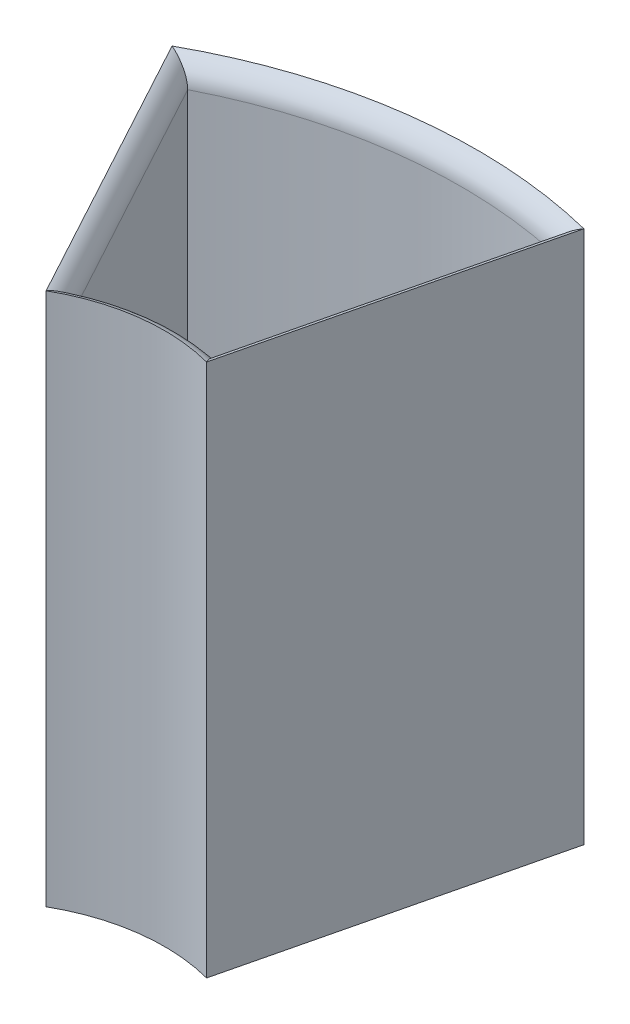
from build123d import *

# Parameters (mm, degrees)
BOSS_EXTRUDE1_DEPTH = 2
BOSS_EXTRUDE2_DEPTH = 65
FILLET1_R           = 3


with BuildPart() as part:
    # Sketch1 → Boss-Extrude1 (new body)
    with BuildSketch(Plane(origin=(0, 0, 0), x_dir=(1, 0, 0), z_dir=(0, 1, 0))):
        with BuildLine():
            Line((-10.560958787, 22.659791471), (-26.773952234, 52.575236393))
            ThreePointArc((-26.773952234, 52.575236393), (-7.656070137, 58.501150331), (12.342908564, 57.69447641))
            Line((12.342908564, 57.69447641), (4.374170949, 24.614358178))
            ThreePointArc((4.374170949, 24.614358178), (-3.244097516, 24.788623022), (-10.560958787, 22.659791471))
        make_face()
    extrude(amount=BOSS_EXTRUDE1_DEPTH)

    # Sketch1<3> → Boss-Extrude2 (add)
    with BuildSketch(Plane(origin=(0, 0, 0), x_dir=(1, 0, 0), z_dir=(0, 1, 0))):
        with BuildLine():
            ThreePointArc((5.859670357, 22.24104906), (-2.984569714, 22.80553318), (-11.385698648, 19.984140369))
            Line((-11.385698648, 19.984140369), (-29.493588104, 53.395957344))
            ThreePointArc((-29.493588104, 53.395957344), (-7.915597938, 60.484240173), (14.75975536, 59.187411007))
            Line((14.75975536, 59.187411007), (5.859670357, 22.24104906))
        make_face()
        with BuildLine():
            Line((4.374170949, 24.614358178), (12.342908564, 57.69447641))
            ThreePointArc((12.342908564, 57.69447641), (-7.656070137, 58.501150331), (-26.773952234, 52.575236393))
            Line((-26.773952234, 52.575236393), (-10.560958787, 22.659791471))
            ThreePointArc((-10.560958787, 22.659791471), (-3.244097516, 24.788623022), (4.374170949, 24.614358178))
        make_face(mode=Mode.SUBTRACT)
    extrude(amount=BOSS_EXTRUDE2_DEPTH)

    # Fillet1
    # the kernel refuses this fillet: 3 mm, written as the material it adds along each edge
    with BuildSketch(Plane(origin=(-6.987336603, 2, -16.065913667), x_dir=(0, 1, 0), z_dir=(-0.4764829578611926, 0, -0.879183707121469))) as fillet1_piece_1_section:
        with BuildLine():
            CenterArc((FILLET1_R, FILLET1_R), FILLET1_R, 180, 90)
            Line((0, FILLET1_R), (0, 0))
            Line((0, 0), (FILLET1_R, 0))
        make_face()
    fillet1_piece_1 = extrude(amount=49.02638684, mode=Mode.PRIVATE)
    fillet1_piece_1 = fillet1_piece_1 & Plane(origin=(0, 2, 0), x_dir=(0.20920184006511774, 0, -0.977872481519635), z_dir=(0, -1, 0)) * Cylinder(59, 111, mode=Mode.PRIVATE)
    fillet1_piece_1 = fillet1_piece_1 - Plane(origin=(0, 2, 0), x_dir=(-0.4224383514814905, 0, -0.9063916588305525), z_dir=(0, -1, 0)) * Cylinder(25, 111, mode=Mode.PRIVATE)
    add(fillet1_piece_1)
    with BuildSketch(Plane(origin=(0, 2, 0), x_dir=(0.4581300705855368, 0, -0.8888851660508748), z_dir=(0.8888851660508748, 0, 0.4581300705855368))) as fillet1_piece_2_section:
        with BuildLine():
            CenterArc((25 + FILLET1_R, FILLET1_R), FILLET1_R, 180, 90)
            Line((25 + FILLET1_R, 0), (25, 0))
            Line((25, 0), (25, FILLET1_R))
        make_face()
    fillet1_piece_2 = revolve(axis=Axis((0, 2, 0), (0, 1, 0)), revolution_arc=69.444918607, mode=Mode.PRIVATE)
    fillet1_piece_2 = split(fillet1_piece_2, bisect_by=Plane(origin=(-1.469933591, 2, -0.354095322), z_dir=(-0.9721901531046743, 0, -0.23419288248431033)), keep=Keep.TOP, mode=Mode.PRIVATE)
    fillet1_piece_2 = split(fillet1_piece_2, bisect_by=Plane(origin=(1.329309559, 2, -0.720433449), z_dir=(0.879183707121469, 0, -0.4764829578611926)), keep=Keep.TOP, mode=Mode.PRIVATE)
    add(fillet1_piece_2)
    with BuildSketch(Plane(origin=(14.099355182, 2, -64.985902558), x_dir=(0, 1, 0), z_dir=(-0.23419288248431033, 0, 0.9721901531046743))) as fillet1_piece_3_section:
        with BuildLine():
            CenterArc((FILLET1_R, FILLET1_R), FILLET1_R, 180, 90)
            Line((0, FILLET1_R), (0, 0))
            Line((0, 0), (FILLET1_R, 0))
        make_face()
    fillet1_piece_3 = extrude(amount=49.02638684, mode=Mode.PRIVATE)
    fillet1_piece_3 = fillet1_piece_3 & Plane(origin=(0, 2, 0), x_dir=(0.20920184006511774, 0, -0.977872481519635), z_dir=(0, -1, 0)) * Cylinder(59, 111, mode=Mode.PRIVATE)
    fillet1_piece_3 = fillet1_piece_3 - Plane(origin=(0, 2, 0), x_dir=(-0.4224383514814905, 0, -0.9063916588305525), z_dir=(0, -1, 0)) * Cylinder(25, 111, mode=Mode.PRIVATE)
    add(fillet1_piece_3)
    with BuildSketch(Plane(origin=(0, 2, 0), x_dir=(-0.5631135264188442, 0, -0.8263795474018787), z_dir=(-0.8263795474018787, 0, 0.5631135264188442))) as fillet1_piece_4_section:
        with BuildLine():
            CenterArc((59 - FILLET1_R, -FILLET1_R), FILLET1_R, 0, 90)
            Line((59 - FILLET1_R, 0), (59, 0))
            Line((59, 0), (59, -FILLET1_R))
        make_face()
    fillet1_piece_4 = revolve(axis=Axis((0, 2, 0), (0, -1, 0)), revolution_arc=53.630888503, mode=Mode.PRIVATE)
    fillet1_piece_4 = split(fillet1_piece_4, bisect_by=Plane(origin=(-1.469933591, 2, -0.354095322), z_dir=(-0.9721901531046743, 0, -0.23419288248431033)), keep=Keep.TOP, mode=Mode.PRIVATE)
    fillet1_piece_4 = split(fillet1_piece_4, bisect_by=Plane(origin=(1.329309559, 2, -0.720433449), z_dir=(0.879183707121469, 0, -0.4764829578611926)), keep=Keep.TOP, mode=Mode.PRIVATE)
    add(fillet1_piece_4)
    # the kernel refuses this fillet: 3 mm, written as the material it takes off along each edge
    with BuildSketch(Plane(origin=(0, 65, 0), x_dir=(-0.6714413755332248, 0, -0.7410576760428644), z_dir=(-0.7410576760428644, 0, 0.6714413755332248))) as fillet1_2_piece_1_section:
        with BuildLine():
            CenterArc((25 - FILLET1_R, FILLET1_R), FILLET1_R, 270, 90)
            Line((25, FILLET1_R), (25, 0))
            Line((25, 0), (25 - FILLET1_R, 0))
        make_face()
    fillet1_2_piece_1 = revolve(axis=Axis((0, 65, 0), (0, -1, 0)), revolution_arc=69.444918607, mode=Mode.PRIVATE)
    fillet1_2_piece_1 = split(fillet1_2_piece_1, bisect_by=Plane(origin=(-1.469933591, 65, -0.354095322), z_dir=(-0.9721901531046743, 0, -0.23419288248431033)), keep=Keep.TOP, mode=Mode.PRIVATE)
    fillet1_2_piece_1 = split(fillet1_2_piece_1, bisect_by=Plane(origin=(1.329309559, 65, -0.720433449), z_dir=(0.879183707121469, 0, -0.4764829578611926)), keep=Keep.TOP, mode=Mode.PRIVATE)
    add(fillet1_2_piece_1, mode=Mode.SUBTRACT)
    with BuildSketch(Plane(origin=(-30.347574418, 65, -59.169114196), x_dir=(-0.879183707121469, 0, 0.47648295786119255), z_dir=(0.4764829578611926, 0, 0.879183707121469))) as fillet1_2_piece_2_section:
        with BuildLine():
            CenterArc((FILLET1_R, FILLET1_R), FILLET1_R, 180, 90)
            Line((0, FILLET1_R), (0, 0))
            Line((0, 0), (FILLET1_R, 0))
        make_face()
    fillet1_2_piece_2 = extrude(amount=49.02638684, mode=Mode.PRIVATE)
    fillet1_2_piece_2 = fillet1_2_piece_2 & Plane(origin=(0, 65, 0), x_dir=(0.20920184006511774, 0, -0.977872481519635), z_dir=(0, -1, 0)) * Cylinder(59, 111, mode=Mode.PRIVATE)
    fillet1_2_piece_2 = fillet1_2_piece_2 - Plane(origin=(0, 65, 0), x_dir=(-0.4224383514814905, 0, -0.9063916588305525), z_dir=(0, -1, 0)) * Cylinder(25, 111, mode=Mode.PRIVATE)
    add(fillet1_2_piece_2, mode=Mode.SUBTRACT)
    with BuildSketch(Plane(origin=(2.617724331, 65, -17.32293203), x_dir=(0.9721901531046743, 0, 0.23419288248431033), z_dir=(0.23419288248431033, 0, -0.9721901531046743))) as fillet1_2_piece_3_section:
        with BuildLine():
            CenterArc((FILLET1_R, FILLET1_R), FILLET1_R, 180, 90)
            Line((0, FILLET1_R), (0, 0))
            Line((0, 0), (FILLET1_R, 0))
        make_face()
    fillet1_2_piece_3 = extrude(amount=49.02638684, mode=Mode.PRIVATE)
    fillet1_2_piece_3 = fillet1_2_piece_3 & Plane(origin=(0, 65, 0), x_dir=(0.20920184006511774, 0, -0.977872481519635), z_dir=(0, -1, 0)) * Cylinder(59, 111, mode=Mode.PRIVATE)
    fillet1_2_piece_3 = fillet1_2_piece_3 - Plane(origin=(0, 65, 0), x_dir=(-0.4224383514814905, 0, -0.9063916588305525), z_dir=(0, -1, 0)) * Cylinder(25, 111, mode=Mode.PRIVATE)
    add(fillet1_2_piece_3, mode=Mode.SUBTRACT)
    with BuildSketch(Plane(origin=(0, 65, 0), x_dir=(0.33149424176414766, 0, -0.9434572421033254), z_dir=(0.9434572421033254, 0, 0.33149424176414766))) as fillet1_2_piece_4_section:
        with BuildLine():
            CenterArc((59 + FILLET1_R, -FILLET1_R), FILLET1_R, 90, 90)
            Line((59, -FILLET1_R), (59, 0))
            Line((59, 0), (59 + FILLET1_R, 0))
        make_face()
    fillet1_2_piece_4 = revolve(axis=Axis((0, 65, 0), (0, 1, 0)), revolution_arc=53.630888503, mode=Mode.PRIVATE)
    fillet1_2_piece_4 = split(fillet1_2_piece_4, bisect_by=Plane(origin=(-1.469933591, 65, -0.354095322), z_dir=(-0.9721901531046743, 0, -0.23419288248431033)), keep=Keep.TOP, mode=Mode.PRIVATE)
    fillet1_2_piece_4 = split(fillet1_2_piece_4, bisect_by=Plane(origin=(1.329309559, 65, -0.720433449), z_dir=(0.879183707121469, 0, -0.4764829578611926)), keep=Keep.TOP, mode=Mode.PRIVATE)
    add(fillet1_2_piece_4, mode=Mode.SUBTRACT)
    with BuildSketch(Plane(origin=(-30.347574418, 65, -59.169114196), x_dir=(-0.879183707121469, 0, 0.47648295786119255), z_dir=(0.4764829578611926, 0, 0.879183707121469))) as fillet1_2_piece_5a_section:
        with BuildLine():
            CenterArc((FILLET1_R, FILLET1_R), FILLET1_R, 180, 90)
            Line((0, FILLET1_R), (0, 0))
            Line((0, 0), (FILLET1_R, 0))
        make_face()
    fillet1_2_piece_5a = extrude(amount=49.02638684, mode=Mode.PRIVATE)
    fillet1_2_piece_5a = fillet1_2_piece_5a - Plane(origin=(0, 65, 0), x_dir=(0.25476827639356225, 0, -0.9670021330604465), z_dir=(0, -1, 0)) * Cylinder(23, 111, mode=Mode.PRIVATE)
    fillet1_2_piece_5a = split(fillet1_2_piece_5a, bisect_by=Plane(origin=(-32.105941832, 65, -58.216148281), z_dir=(0.8791837071214691, 0, -0.47648295786119255)), keep=Keep.TOP, mode=Mode.PRIVATE)
    fillet1_2_piece_5a = fillet1_2_piece_5a & Plane(origin=(0, 65, 0), x_dir=(-0.4224383514814905, 0, -0.9063916588305525), z_dir=(0, -1, 0)) * Cylinder(25, 111, mode=Mode.PRIVATE)
    with BuildSketch(Plane(origin=(0, 65, 0), x_dir=(-0.6714413755332248, 0, -0.7410576760428644), z_dir=(-0.7410576760428644, 0, 0.6714413755332248))) as fillet1_2_piece_5b_section:
        with BuildLine():
            CenterArc((25 - FILLET1_R, FILLET1_R), FILLET1_R, 270, 90)
            Line((25, FILLET1_R), (25, 0))
            Line((25, 0), (25 - FILLET1_R, 0))
        make_face()
    fillet1_2_piece_5b = revolve(axis=Axis((0, 65, 0), (0, -1, 0)), revolution_arc=69.444918607, mode=Mode.PRIVATE)
    fillet1_2_piece_5b = fillet1_2_piece_5b - Plane(origin=(0, 65, 0), x_dir=(0.25476827639356225, 0, -0.9670021330604465), z_dir=(0, -1, 0)) * Cylinder(23, 100, mode=Mode.PRIVATE)
    fillet1_2_piece_5b = split(fillet1_2_piece_5b, bisect_by=Plane(origin=(-0.429057855, 65, 0.232532466), z_dir=(0.8791837071214691, 0, -0.47648295786119255)), keep=Keep.TOP, mode=Mode.PRIVATE)
    fillet1_2_piece_5b = split(fillet1_2_piece_5b, bisect_by=Plane(origin=(1.329309559, 65, -0.720433449), z_dir=(-0.879183707121469, 0, 0.4764829578611926)), keep=Keep.TOP, mode=Mode.PRIVATE)
    fillet1_2_piece_5 = fillet1_2_piece_5a & fillet1_2_piece_5b
    add(fillet1_2_piece_5, mode=Mode.SUBTRACT)
    with BuildSketch(Plane(origin=(2.617724331, 65, -17.32293203), x_dir=(0.9721901531046743, 0, 0.23419288248431033), z_dir=(0.23419288248431033, 0, -0.9721901531046743))) as fillet1_2_piece_6a_section:
        with BuildLine():
            CenterArc((FILLET1_R, FILLET1_R), FILLET1_R, 180, 90)
            Line((0, FILLET1_R), (0, 0))
            Line((0, 0), (FILLET1_R, 0))
        make_face()
    fillet1_2_piece_6a = extrude(amount=49.02638684, mode=Mode.PRIVATE)
    fillet1_2_piece_6a = split(fillet1_2_piece_6a, bisect_by=Plane(origin=(4.562104637, 65, -16.854546265), z_dir=(-0.9721901531046744, 0, -0.23419288248431033)), keep=Keep.TOP, mode=Mode.PRIVATE)
    fillet1_2_piece_6a = fillet1_2_piece_6a - Plane(origin=(0, 65, 0), x_dir=(0.25476827639356225, 0, -0.9670021330604465), z_dir=(0, -1, 0)) * Cylinder(23, 111, mode=Mode.PRIVATE)
    fillet1_2_piece_6a = fillet1_2_piece_6a & Plane(origin=(0, 65, 0), x_dir=(-0.4224383514814905, 0, -0.9063916588305525), z_dir=(0, -1, 0)) * Cylinder(25, 111, mode=Mode.PRIVATE)
    with BuildSketch(Plane(origin=(0, 65, 0), x_dir=(-0.6714413755332248, 0, -0.7410576760428644), z_dir=(-0.7410576760428644, 0, 0.6714413755332248))) as fillet1_2_piece_6b_section:
        with BuildLine():
            CenterArc((25 - FILLET1_R, FILLET1_R), FILLET1_R, 270, 90)
            Line((25, FILLET1_R), (25, 0))
            Line((25, 0), (25 - FILLET1_R, 0))
        make_face()
    fillet1_2_piece_6b = revolve(axis=Axis((0, 65, 0), (0, -1, 0)), revolution_arc=69.444918607, mode=Mode.PRIVATE)
    fillet1_2_piece_6b = split(fillet1_2_piece_6b, bisect_by=Plane(origin=(0.474446715, 65, 0.114290443), z_dir=(-0.9721901531046744, 0, -0.23419288248431033)), keep=Keep.TOP, mode=Mode.PRIVATE)
    fillet1_2_piece_6b = fillet1_2_piece_6b - Plane(origin=(0, 65, 0), x_dir=(0.25476827639356225, 0, -0.9670021330604465), z_dir=(0, -1, 0)) * Cylinder(23, 100, mode=Mode.PRIVATE)
    fillet1_2_piece_6b = split(fillet1_2_piece_6b, bisect_by=Plane(origin=(-1.469933591, 65, -0.354095322), z_dir=(0.9721901531046743, 0, 0.23419288248431033)), keep=Keep.TOP, mode=Mode.PRIVATE)
    fillet1_2_piece_6 = fillet1_2_piece_6a & fillet1_2_piece_6b
    add(fillet1_2_piece_6, mode=Mode.SUBTRACT)
    with BuildSketch(Plane(origin=(0, 65, 0), x_dir=(0.33149424176414766, 0, -0.9434572421033254), z_dir=(0.9434572421033254, 0, 0.33149424176414766))) as fillet1_2_piece_7a_section:
        with BuildLine():
            CenterArc((59 + FILLET1_R, -FILLET1_R), FILLET1_R, 90, 90)
            Line((59, -FILLET1_R), (59, 0))
            Line((59, 0), (59 + FILLET1_R, 0))
        make_face()
    fillet1_2_piece_7a = revolve(axis=Axis((0, 65, 0), (0, 1, 0)), revolution_arc=53.630888503, mode=Mode.PRIVATE)
    fillet1_2_piece_7a = fillet1_2_piece_7a & Plane(origin=(0, 65, 0), x_dir=(-0.4835014443344291, 0, -0.8753435630234113), z_dir=(0, -1, 0)) * Cylinder(61, 248, mode=Mode.PRIVATE)
    fillet1_2_piece_7a = split(fillet1_2_piece_7a, bisect_by=Plane(origin=(-0.429057855, 65, 0.232532466), z_dir=(0.8791837071214691, 0, -0.47648295786119255)), keep=Keep.TOP, mode=Mode.PRIVATE)
    fillet1_2_piece_7a = split(fillet1_2_piece_7a, bisect_by=Plane(origin=(1.329309559, 65, -0.720433449), z_dir=(-0.879183707121469, 0, 0.4764829578611926)), keep=Keep.TOP, mode=Mode.PRIVATE)
    with BuildSketch(Plane(origin=(-30.347574418, 65, -59.169114196), x_dir=(-0.879183707121469, 0, 0.47648295786119255), z_dir=(0.4764829578611926, 0, 0.879183707121469))) as fillet1_2_piece_7b_section:
        with BuildLine():
            CenterArc((FILLET1_R, FILLET1_R), FILLET1_R, 180, 90)
            Line((0, FILLET1_R), (0, 0))
            Line((0, 0), (FILLET1_R, 0))
        make_face()
    fillet1_2_piece_7b = extrude(amount=49.02638684, mode=Mode.PRIVATE)
    fillet1_2_piece_7b = fillet1_2_piece_7b & Plane(origin=(0, 65, 0), x_dir=(-0.4835014443344291, 0, -0.8753435630234113), z_dir=(0, -1, 0)) * Cylinder(61, 111, mode=Mode.PRIVATE)
    fillet1_2_piece_7b = split(fillet1_2_piece_7b, bisect_by=Plane(origin=(-32.105941832, 65, -58.216148281), z_dir=(0.8791837071214691, 0, -0.47648295786119255)), keep=Keep.TOP, mode=Mode.PRIVATE)
    fillet1_2_piece_7b = fillet1_2_piece_7b - Plane(origin=(0, 65, 0), x_dir=(0.20920184006511774, 0, -0.977872481519635), z_dir=(0, -1, 0)) * Cylinder(59, 111, mode=Mode.PRIVATE)
    fillet1_2_piece_7 = fillet1_2_piece_7a & fillet1_2_piece_7b
    add(fillet1_2_piece_7, mode=Mode.SUBTRACT)
    with BuildSketch(Plane(origin=(2.617724331, 65, -17.32293203), x_dir=(0.9721901531046743, 0, 0.23419288248431033), z_dir=(0.23419288248431033, 0, -0.9721901531046743))) as fillet1_2_piece_8a_section:
        with BuildLine():
            CenterArc((FILLET1_R, FILLET1_R), FILLET1_R, 180, 90)
            Line((0, FILLET1_R), (0, 0))
            Line((0, 0), (FILLET1_R, 0))
        make_face()
    fillet1_2_piece_8a = extrude(amount=49.02638684, mode=Mode.PRIVATE)
    fillet1_2_piece_8a = fillet1_2_piece_8a & Plane(origin=(0, 65, 0), x_dir=(-0.4835014443344291, 0, -0.8753435630234113), z_dir=(0, -1, 0)) * Cylinder(61, 111, mode=Mode.PRIVATE)
    fillet1_2_piece_8a = split(fillet1_2_piece_8a, bisect_by=Plane(origin=(4.562104637, 65, -16.854546265), z_dir=(-0.9721901531046744, 0, -0.23419288248431033)), keep=Keep.TOP, mode=Mode.PRIVATE)
    fillet1_2_piece_8a = fillet1_2_piece_8a - Plane(origin=(0, 65, 0), x_dir=(0.20920184006511774, 0, -0.977872481519635), z_dir=(0, -1, 0)) * Cylinder(59, 111, mode=Mode.PRIVATE)
    with BuildSketch(Plane(origin=(0, 65, 0), x_dir=(0.33149424176414766, 0, -0.9434572421033254), z_dir=(0.9434572421033254, 0, 0.33149424176414766))) as fillet1_2_piece_8b_section:
        with BuildLine():
            CenterArc((59 + FILLET1_R, -FILLET1_R), FILLET1_R, 90, 90)
            Line((59, -FILLET1_R), (59, 0))
            Line((59, 0), (59 + FILLET1_R, 0))
        make_face()
    fillet1_2_piece_8b = revolve(axis=Axis((0, 65, 0), (0, 1, 0)), revolution_arc=53.630888503, mode=Mode.PRIVATE)
    fillet1_2_piece_8b = fillet1_2_piece_8b & Plane(origin=(0, 65, 0), x_dir=(-0.4835014443344291, 0, -0.8753435630234113), z_dir=(0, -1, 0)) * Cylinder(61, 248, mode=Mode.PRIVATE)
    fillet1_2_piece_8b = split(fillet1_2_piece_8b, bisect_by=Plane(origin=(0.474446715, 65, 0.114290443), z_dir=(-0.9721901531046744, 0, -0.23419288248431033)), keep=Keep.TOP, mode=Mode.PRIVATE)
    fillet1_2_piece_8b = split(fillet1_2_piece_8b, bisect_by=Plane(origin=(-1.469933591, 65, -0.354095322), z_dir=(0.9721901531046743, 0, 0.23419288248431033)), keep=Keep.TOP, mode=Mode.PRIVATE)
    fillet1_2_piece_8 = fillet1_2_piece_8a & fillet1_2_piece_8b
    add(fillet1_2_piece_8, mode=Mode.SUBTRACT)


solid = part.part
